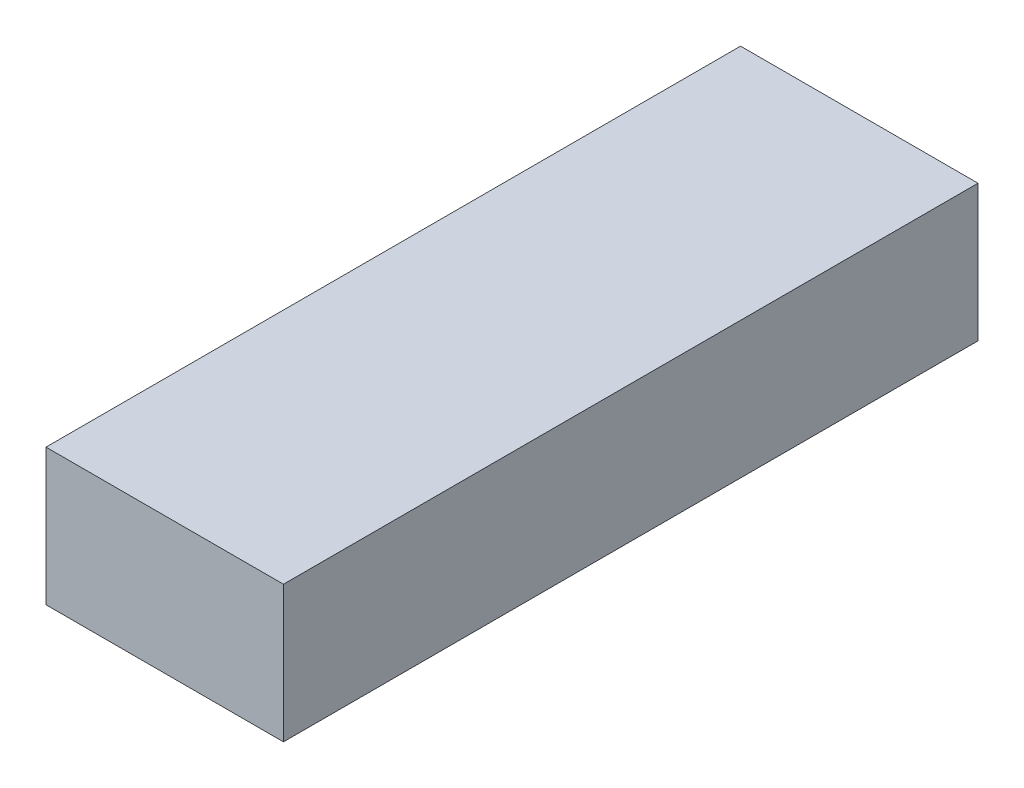
from build123d import *

# Parameters (mm, degrees)
ESQUISSE1_W        = 40
ESQUISSE1_H        = 23
BOSS_EXTRU_1_DEPTH = 117


with BuildPart() as part:
    # Esquisse1 → Boss.-Extru.1 (new body)
    with BuildSketch(Plane.XY):
        with Locations((20, 11.5)):
            Rectangle(ESQUISSE1_W, ESQUISSE1_H)
    extrude(amount=BOSS_EXTRU_1_DEPTH)


solid = part.part
